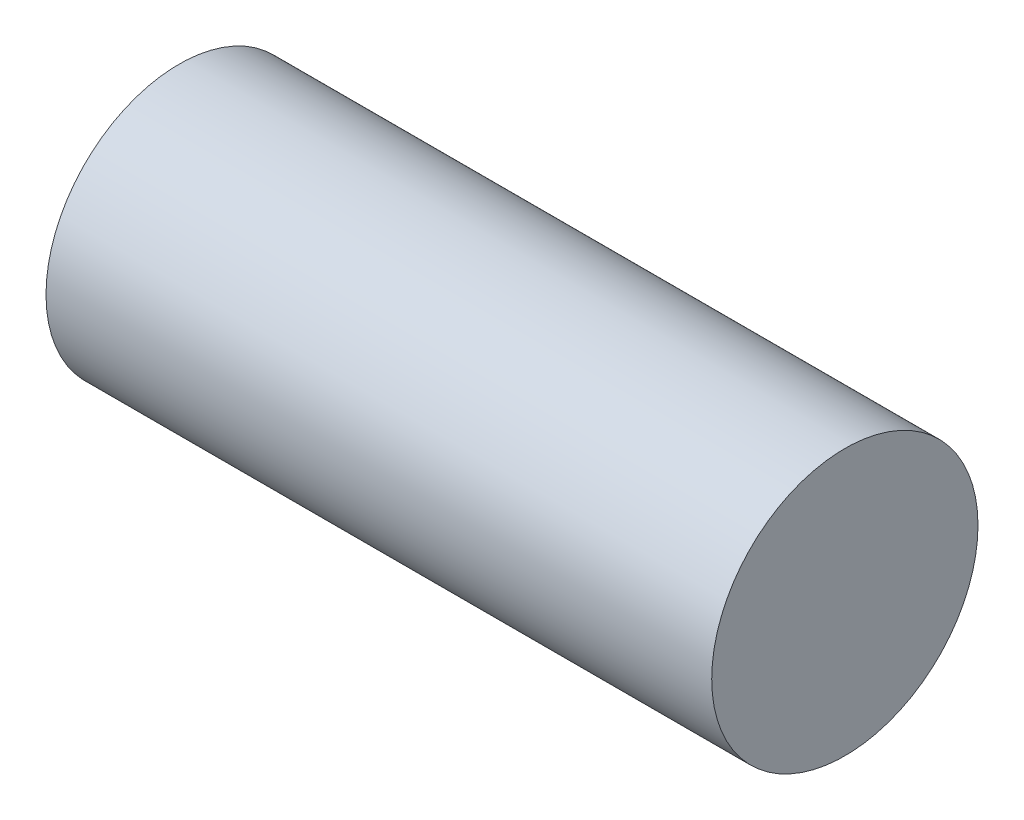
from build123d import *

# Parameters (mm, degrees)
SKETCH1_R           = 150
BOSS_EXTRUDE1_DEPTH = 750


with BuildPart() as part:
    # Sketch1 → Boss-Extrude1 (new body)
    with BuildSketch(Plane(origin=(0, 0, 0), x_dir=(0, 0, -1), z_dir=(1, 0, 0))):
        Circle(SKETCH1_R)
    extrude(amount=BOSS_EXTRUDE1_DEPTH)


solid = part.part
